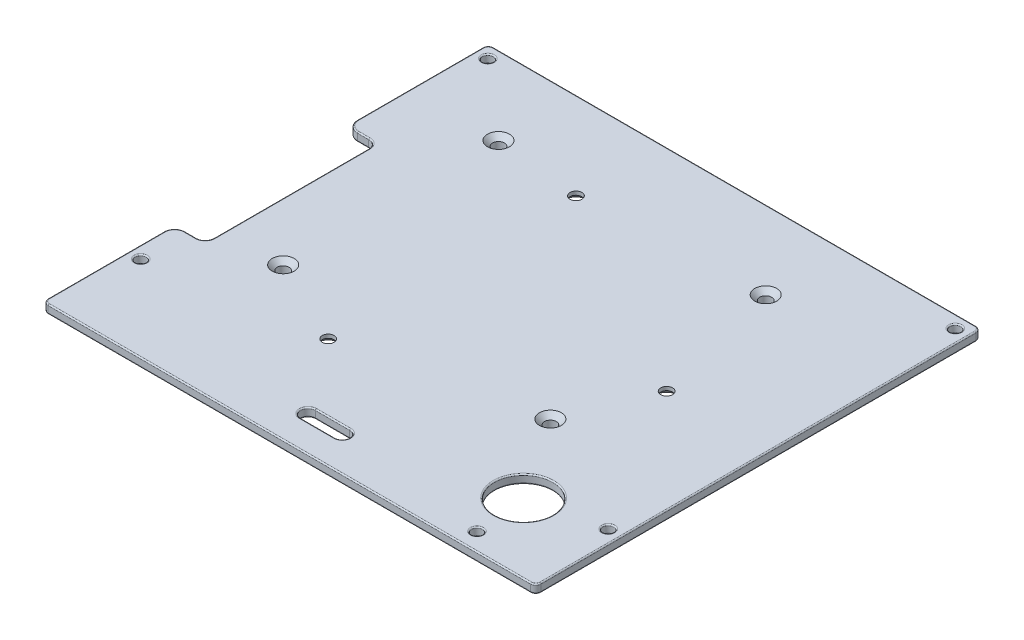
from build123d import *

# Parameters (mm, degrees)
BOSS_EXTRUDE1_START                            = -5.5
BOSS_EXTRUDE1_DEPTH                            = 2.5
SKETCH2_R                                      = 1.55
SKETCH2_R_2                                    = 8.35
SKETCH2_R_3                                    = 0.25
CUT_EXTRUDE5_DEPTH                             = 2.5
FILLET1_R                                      = 0.35
CSK_FOR_M3_FLAT_HEAD_MACHINE_SCREW1_AT_2_COUNT = 2
CSK_FOR_M3_FLAT_HEAD_MACHINE_SCREW1_AT_2_PITCH = 76.6
CSK_FOR_M3_FLAT_HEAD_MACHINE_SCREW1_AT_3_COUNT = 2
CSK_FOR_M3_FLAT_HEAD_MACHINE_SCREW1_AT_3_PITCH = 98.371329156
CSK_FOR_M3_FLAT_HEAD_MACHINE_SCREW1_AT_4_COUNT = 2
CSK_FOR_M3_FLAT_HEAD_MACHINE_SCREW1_AT_4_PITCH = 61.720000004
SKETCH9_R                                      = 0.25
CUT_EXTRUDE7_DEPTH                             = 101.214391699
CSK_FOR_M3_FLAT_HEAD_MACHINE_SCREW2_AT_2_COUNT = 2
CSK_FOR_M3_FLAT_HEAD_MACHINE_SCREW2_AT_2_PITCH = 71.01408311
CSK_FOR_M3_FLAT_HEAD_MACHINE_SCREW2_AT_3_COUNT = 2
CSK_FOR_M3_FLAT_HEAD_MACHINE_SCREW2_AT_3_PITCH = 71.01408311
FILLET2_R                                      = 3
SKETCH17_R                                     = 4.5
SKETCH17_R_2                                   = 1.7
BOSS_EXTRUDE2_DEPTH                            = 5
FILLET3_R                                      = 3


with BuildPart() as part:
    # Sketch1 → Boss-Extrude1 (new body)
    with BuildSketch(Plane(origin=(0, 0, 0), x_dir=(1, 0, 0), z_dir=(0, 1, 0)).offset(BOSS_EXTRUDE1_START)):
        with BuildLine():
            Line((74.113861426, -65.72075976), (-64.157066783, -65.72075976))
            ThreePointArc((-64.157066783, -65.72075976), (-65.217726955, -65.281419931), (-65.657066783, -64.22075976))
            Line((-65.657066783, -64.22075976), (-65.657066783, 60.423475085))
            ThreePointArc((-65.657066783, 60.423475085), (-65.217726955, 61.484135257), (-64.157066783, 61.923475085))
            Line((-64.157066783, 61.923475085), (74.113861426, 61.923475085))
            ThreePointArc((74.113861426, 61.923475085), (75.174521598, 61.484135257), (75.613861426, 60.423475085))
            Line((75.613861426, 60.423475085), (75.613861426, -64.22075976))
            ThreePointArc((75.613861426, -64.22075976), (75.174521598, -65.281419931), (74.113861426, -65.72075976))
        make_face()
    extrude(amount=-BOSS_EXTRUDE1_DEPTH)

    # Sketch2 → Cut-Extrude5 (cut)
    with BuildSketch(Plane(origin=(0, -8, 0), x_dir=(-1, 0, 0), z_dir=(0, -1, 0))):
        with Locations(Location((62.130058611, -41.219781732, 0), (0, 0, 90))):
            Circle(SKETCH2_R)
        with Locations(Location((-71.869941389, -41.219781732, 0), (0, 0, 90))):
            Circle(SKETCH2_R)
        with Locations(Location((-71.869941389, 58.280218268, 0), (0, 0, 90))):
            Circle(SKETCH2_R)
        with Locations(Location((62.130058611, 58.280218268, 0), (0, 0, 90))):
            Circle(SKETCH2_R)
        with Locations(Location((-53.652742829, -60.614920028, 0), (0, 0, 90))):
            Circle(SKETCH2_R)
        with Locations(Location((-52.062540252, -45.661038294, 0), (0, 0, 90))):
            Circle(SKETCH2_R_2)
        with Locations(Location((-36.330028462, 39.476727654, 0), (0, 0, 90))):
            Circle(SKETCH2_R_3)
        with Locations(Location((40.269971538, 39.476727654, 0), (0, 0, 90))):
            Circle(SKETCH2_R_3)
        with Locations(Location((40.269971538, -22.243272346, 0), (0, 0, 90))):
            Circle(SKETCH2_R_3)
        with Locations(Location((-36.330028462, -22.24327235, 0), (0, 0, 90))):
            Circle(SKETCH2_R_3)
        with BuildLine():
            Line((-0.208237226, -57.72035864), (-10.027678184, -57.72035864))
            ThreePointArc((-10.027678184, -57.72035864), (-12.152678184, -55.59535864), (-10.027678184, -53.47035864))
            Line((-10.027678184, -53.47035864), (-0.208237226, -53.47035864))
            ThreePointArc((-0.208237226, -53.47035864), (1.916762774, -55.59535864), (-0.208237226, -57.72035864))
        make_face()
        with BuildLine():
            Line((65.657066783, -27.976897452), (59.384043685, -27.976897452))
            ThreePointArc((59.384043685, -27.976897452), (57.616276732, -27.244664405), (56.884043685, -25.476897452))
            Line((56.884043685, -25.476897452), (56.884043685, 18.901725122))
            ThreePointArc((56.884043685, 18.901725122), (57.616276732, 20.669492075), (59.384043685, 21.401725122))
            Line((59.384043685, 21.401725122), (65.657066783, 21.401725122))
            Line((65.657066783, 21.401725122), (65.657066783, -27.976897452))
        make_face()
    extrude(amount=-CUT_EXTRUDE5_DEPTH, mode=Mode.SUBTRACT)

    # Fillet1
    fillet1_edges = [part.edges().sort_by_distance(p)[0] for p in [
        (75.174521598, -8, 65.281419931),
        (4.978397322, -5.5, 65.72075976),
        (-65.217726955, -5.5, 65.281419931),
        (75.613861426, -8, 1.898642337),
        (75.174521598, -8, -61.484135257),
        (4.978397322, -8, -61.923475085),
        (-65.217726955, -8, -61.484135257),
        (-65.657066783, -5.5, 46.098828606),
        (-65.657066783, -8, -40.912600104),
        (-65.657066783, -8, 46.098828606),
        (-65.217726955, -8, 65.281419931),
        (36.330028462, -5.5, -39.226727654),
        (36.330028462, -8, -39.226727654),
        (-1.916762774, -5.5, 55.59535864),
        (5.117957705, -5.5, 57.72035864),
        (12.152678184, -5.5, 55.59535864),
        (5.117957705, -5.5, 53.47035864),
        (-1.916762774, -8, 55.59535864),
        (5.117957705, -8, 53.47035864),
        (12.152678184, -8, 55.59535864),
        (5.117957705, -8, 57.72035864),
        (52.062540252, -5.5, 54.011038294),
        (52.062540252, -8, 54.011038294),
        (53.652742829, -5.5, 62.164920028),
        (53.652742829, -8, 62.164920028),
        (-62.130058611, -5.5, -56.730218268),
        (-62.130058611, -8, -56.730218268),
        (71.869941389, -5.5, -56.730218268),
        (71.869941389, -8, -56.730218268),
        (71.869941389, -5.5, 42.769781732),
        (71.869941389, -8, 42.769781732),
        (-62.520555234, -5.5, 27.976897452),
        (-57.616276732, -5.5, 27.244664405),
        (-56.884043685, -5.5, 3.287586165),
        (-57.616276732, -5.5, -20.669492075),
        (-62.520555234, -5.5, -21.401725122),
        (-62.520555234, -8, -21.401725122),
        (-57.616276732, -8, -20.669492075),
        (-56.884043685, -8, 3.287586165),
        (-57.616276732, -8, 27.244664405),
        (-62.520555234, -8, 27.976897452),
        (4.978397322, -8, 65.72075976),
        (-40.269971538, -5.5, -39.226727654),
        (-40.269971538, -8, -39.226727654),
        (-40.269971538, -5.5, 22.493272346),
        (-40.269971538, -8, 22.493272346),
        (36.330028462, -5.5, 22.49327235),
        (36.330028462, -8, 22.49327235),
        (-62.130058611, -5.5, 42.769781732),
        (-62.130058611, -8, 42.769781732),
        (-65.657066783, -5.5, -40.912600104),
        (-65.217726955, -5.5, -61.484135257),
        (4.978397322, -5.5, -61.923475085),
        (75.174521598, -5.5, -61.484135257),
        (75.613861426, -5.5, 1.898642337),
        (75.174521598, -5.5, 65.281419931),
    ]]
    fillet(fillet1_edges, radius=FILLET1_R)

    # Sketch6 → CSK for M3 Flat Head Machine Screw1 (revolve, cut)
    with BuildSketch(Plane(origin=(36.330028462, -5.5, -39.476727654), x_dir=(0, 0, 1), z_dir=(1, 0, 0))):
        Polygon((0, 0), (0, 2.5), (1.7, 2.5), (1.7, 1.45), (3.15, 0), align=None)
    csk_for_m3_flat_head_machine_screw1 = revolve(axis=Axis((36.330028462, 0.85, -39.476727654), (0, -1, 0)), mode=Mode.SUBTRACT)

    # CSK for M3 Flat Head Machine Screw1 at 2: CSK for M3 Flat Head Machine Screw1 ×2
    with Locations(*[(-i * CSK_FOR_M3_FLAT_HEAD_MACHINE_SCREW1_AT_2_PITCH, 0, 0) for i in range(1, CSK_FOR_M3_FLAT_HEAD_MACHINE_SCREW1_AT_2_COUNT)]):
        add(csk_for_m3_flat_head_machine_screw1, mode=Mode.SUBTRACT)

    # CSK for M3 Flat Head Machine Screw1 at 3: CSK for M3 Flat Head Machine Screw1 ×2
    with Locations(*[Vector(-0.7786821694581578, 0, 0.627418583537288) * (i * CSK_FOR_M3_FLAT_HEAD_MACHINE_SCREW1_AT_3_PITCH) for i in range(1, CSK_FOR_M3_FLAT_HEAD_MACHINE_SCREW1_AT_3_COUNT)]):
        add(csk_for_m3_flat_head_machine_screw1, mode=Mode.SUBTRACT)

    # CSK for M3 Flat Head Machine Screw1 at 4: CSK for M3 Flat Head Machine Screw1 ×2
    with Locations(*[(0, 0, i * CSK_FOR_M3_FLAT_HEAD_MACHINE_SCREW1_AT_4_PITCH) for i in range(1, CSK_FOR_M3_FLAT_HEAD_MACHINE_SCREW1_AT_4_COUNT)]):
        add(csk_for_m3_flat_head_machine_screw1, mode=Mode.SUBTRACT)

    # Sketch9 → Cut-Extrude7 (cut, through all)
    with BuildSketch(Plane(origin=(0, -5.5, 0), x_dir=(1, 0, 0), z_dir=(0, 1, 0))):
        with Locations(Location((46.073721835, 1.327780123, 0), (0, 0, 270))):
            Circle(SKETCH9_R)
        with Locations(Location((-15.426278165, -34.179261432, 0), (0, 0, 270))):
            Circle(SKETCH9_R)
        with Locations(Location((-15.426278165, 36.834821679, 0), (0, 0, 270))):
            Circle(SKETCH9_R)
    extrude(amount=-CUT_EXTRUDE7_DEPTH, mode=Mode.SUBTRACT)

    # Sketch15 → CSK for M3 Flat Head Machine Screw2 (revolve, cut)
    with BuildSketch(Plane(origin=(-15.426278165, -8, 34.179261432), x_dir=(0, 0, -1), z_dir=(1, 0, 0))):
        Polygon((0, 0), (0, 2.5), (1.7, 2.5), (1.7, 1.45), (3.15, 0), align=None)
    csk_for_m3_flat_head_machine_screw2 = revolve(axis=Axis((-15.426278165, -14.35, 34.179261432), (0, 1, 0)), mode=Mode.SUBTRACT)

    # CSK for M3 Flat Head Machine Screw2 at 2: CSK for M3 Flat Head Machine Screw2 ×2
    with Locations(*[Vector(0.8660254037844399, 0, -0.4999999999999978) * (i * CSK_FOR_M3_FLAT_HEAD_MACHINE_SCREW2_AT_2_PITCH) for i in range(1, CSK_FOR_M3_FLAT_HEAD_MACHINE_SCREW2_AT_2_COUNT)]):
        add(csk_for_m3_flat_head_machine_screw2, mode=Mode.SUBTRACT)

    # CSK for M3 Flat Head Machine Screw2 at 3: CSK for M3 Flat Head Machine Screw2 ×2
    with Locations(*[(0, 0, -i * CSK_FOR_M3_FLAT_HEAD_MACHINE_SCREW2_AT_3_PITCH) for i in range(1, CSK_FOR_M3_FLAT_HEAD_MACHINE_SCREW2_AT_3_COUNT)]):
        add(csk_for_m3_flat_head_machine_screw2, mode=Mode.SUBTRACT)

    # Fillet2
    # the kernel refuses this fillet: 3 mm, written as the material it takes off along each edge
    with BuildSketch(Plane(origin=(-62.657066783, -8, -24.401725122), x_dir=(0, 0, 1), z_dir=(1, 0, 0))) as fillet2_piece_1:
        with BuildLine():
            CenterArc((2.65, -0.35), 0.35, 0, 90)
            Line((3, -0.35), (3, 0))
            Line((3, 0), (2.65, 0))
        make_face()
    revolve(axis=Axis((-62.657066783, -8, -24.401725122), (0, -1, 0)), revolution_arc=90, mode=Mode.SUBTRACT)
    with BuildSketch(Plane(origin=(-62.657066783, -8, 30.976897452), x_dir=(-1, 0, 0), z_dir=(0, 0, 1))) as fillet2_piece_2:
        with BuildLine():
            CenterArc((2.65, -0.35), 0.35, 0, 90)
            Line((3, -0.35), (3, 0))
            Line((3, 0), (2.65, 0))
        make_face()
    revolve(axis=Axis((-62.657066783, -8, 30.976897452), (0, -1, 0)), revolution_arc=90, mode=Mode.SUBTRACT)
    with BuildSketch(Plane(origin=(-62.657066783, -5.5, -24.401725122), x_dir=(-1, 0, 0), z_dir=(0, 0, -1))) as fillet2_piece_3:
        with BuildLine():
            CenterArc((2.65, -0.35), 0.35, 0, 90)
            Line((3, -0.35), (3, 0))
            Line((3, 0), (2.65, 0))
        make_face()
    revolve(axis=Axis((-62.657066783, -5.5, -24.401725122), (0, 1, 0)), revolution_arc=90, mode=Mode.SUBTRACT)
    with BuildSketch(Plane(origin=(-62.657066783, -5.5, 30.976897452), x_dir=(0, 0, -1), z_dir=(1, 0, 0))) as fillet2_piece_4:
        with BuildLine():
            CenterArc((2.65, -0.35), 0.35, 0, 90)
            Line((3, -0.35), (3, 0))
            Line((3, 0), (2.65, 0))
        make_face()
    revolve(axis=Axis((-62.657066783, -5.5, 30.976897452), (0, 1, 0)), revolution_arc=90, mode=Mode.SUBTRACT)
    with BuildSketch(Plane(origin=(-65.657066783, -8, 27.976897452), x_dir=(0, 0, 1), z_dir=(0, 1, 0))) as fillet2_piece_5:
        with BuildLine():
            CenterArc((FILLET2_R, FILLET2_R), FILLET2_R, 180, 90)
            Line((0, FILLET2_R), (0, 0))
            Line((0, 0), (FILLET2_R, 0))
        make_face()
    extrude(amount=2.5, mode=Mode.SUBTRACT)
    with BuildSketch(Plane(origin=(-65.657066783, -8, -21.401725122), x_dir=(0, 0, -1), z_dir=(0, 1, 0))) as fillet2_piece_6:
        with BuildLine():
            CenterArc((FILLET2_R, -FILLET2_R), FILLET2_R, 90, 90)
            Line((0, -FILLET2_R), (0, 0))
            Line((0, 0), (FILLET2_R, 0))
        make_face()
    extrude(amount=2.5, mode=Mode.SUBTRACT)

    # Sketch17 → Boss-Extrude2 (add)
    # profile 1 of 4: a face of its own
    with BuildSketch(Plane(origin=(0, -8, 0), x_dir=(-1, 0, 0), z_dir=(0, -1, 0))):
        with Locations(Location((-36.330028462, 39.476727654, 0), (0, 0, 90))):
            Circle(SKETCH17_R)
        with Locations(Location((-36.330028462, 39.476727654, 0), (0, 0, 270))):
            Circle(SKETCH17_R_2, mode=Mode.SUBTRACT)
    # profile 2 of 4: a face of its own
    with BuildSketch(Plane(origin=(0, -8, 0), x_dir=(-1, 0, 0), z_dir=(0, -1, 0))):
        with Locations(Location((40.269971538, 39.476727654, 0), (0, 0, 90))):
            Circle(SKETCH17_R)
        with Locations(Location((40.269971538, 39.476727654, 0), (0, 0, 270))):
            Circle(SKETCH17_R_2, mode=Mode.SUBTRACT)
    # profile 3 of 4: a face of its own
    with BuildSketch(Plane(origin=(0, -8, 0), x_dir=(-1, 0, 0), z_dir=(0, -1, 0))):
        with Locations(Location((40.269971538, -22.243272346, 0), (0, 0, 90))):
            Circle(SKETCH17_R)
        with Locations(Location((40.269971538, -22.243272346, 0), (0, 0, 270))):
            Circle(SKETCH17_R_2, mode=Mode.SUBTRACT)
    # profile 4 of 4: a face of its own
    with BuildSketch(Plane(origin=(0, -8, 0), x_dir=(-1, 0, 0), z_dir=(0, -1, 0))):
        with Locations(Location((-36.330028462, -22.243272346, 0), (0, 0, 90))):
            Circle(SKETCH17_R)
        with Locations(Location((-36.330028462, -22.243272346, 0), (0, 0, 270))):
            Circle(SKETCH17_R_2, mode=Mode.SUBTRACT)
    extrude(amount=BOSS_EXTRUDE2_DEPTH)

    # Fillet3
    fillet3_edges = [part.edges().sort_by_distance(p)[0] for p in [
        (36.330028462, -8, -34.976727654),
        (-40.269971538, -8, -34.976727654),
        (-40.269971538, -8, 26.743272346),
        (36.330028462, -8, 26.743272346),
    ]]
    fillet(fillet3_edges, radius=FILLET3_R)


solid = part.part
